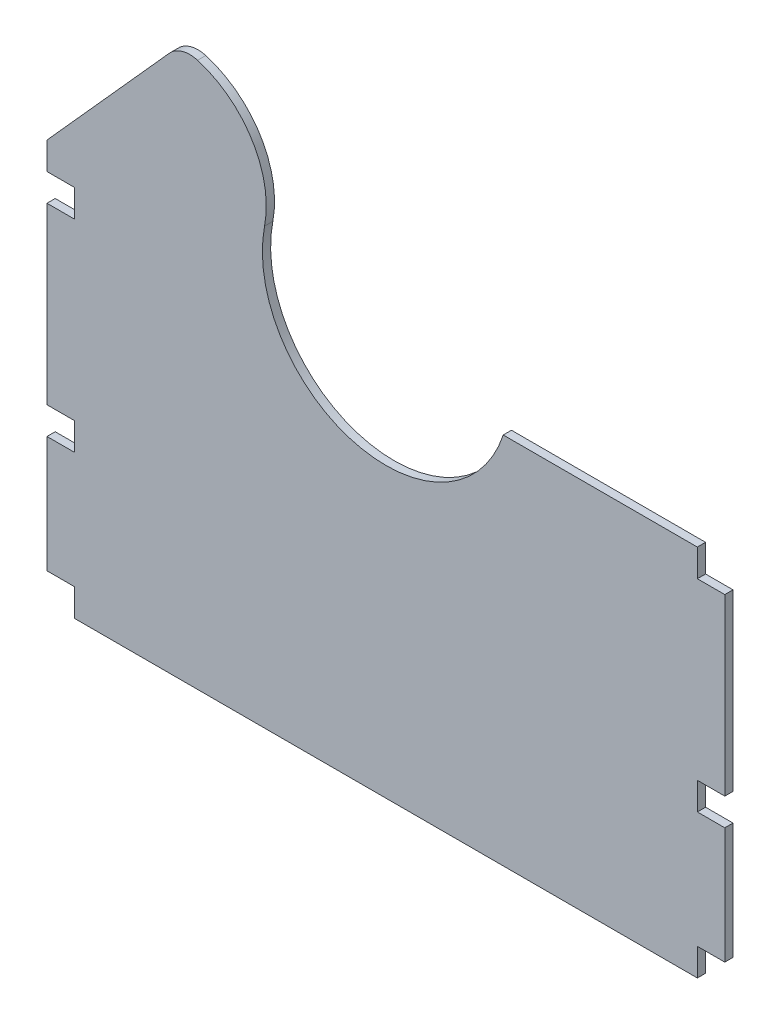
from build123d import *

# Parameters (mm, degrees)
BOSS_EXTRU_1_DEPTH      = 3
ENL_V_MAT_EXTRU_1_DEPTH = 345.268848431
ESQUISSE4_W             = 10
ESQUISSE4_H             = 10
ENL_V_MAT_EXTRU_2_DEPTH = 331.898715622
ENL_V_MAT_EXTRU_3_DEPTH = 331.898715622
CONG_2_R                = 10
ENL_V_MAT_EXTRU_4_DEPTH = 331.274729043


with BuildPart() as part:
    # Esquisse1 → Boss.-Extru.1 (new body)
    with BuildSketch(Plane.XY):
        Polygon((0, 0), (0, 127.45), (65.1, 200), (215.1, 200), (280.2, 127.45), (280.2, 0), align=None)
    extrude(amount=BOSS_EXTRU_1_DEPTH)

    # Esquisse2 → Enlèv. mat.-Extru.1 (cut, through all)
    with BuildSketch(Plane(origin=(0, 0, 0), x_dir=(-1, 0, 0), z_dir=(0, 0, -1))):
        Polygon((-16.6, 0), (-16.6, 145.969439351), (0, 127.45), (0, 0), align=None)
        Polygon((-280.2, 127.45), (-263.6, 145.969439351), (-263.6, 0), (-280.2, 0), align=None)
    extrude(amount=-ENL_V_MAT_EXTRU_1_DEPTH, mode=Mode.SUBTRACT)

    # Esquisse4 → Enlèv. mat.-Extru.2 (cut, through all)
    with BuildSketch(Plane.XY.offset(3)):
        with Locations((21.6, 5)):
            Rectangle(ESQUISSE4_W, ESQUISSE4_H)
        with Locations((21.6, 57.4)):
            Rectangle(ESQUISSE4_W, ESQUISSE4_H)
        with Locations((258.6, 131)):
            Rectangle(ESQUISSE4_W, ESQUISSE4_H)
        with Locations((21.6, 131)):
            Rectangle(ESQUISSE4_W, ESQUISSE4_H)
        with Locations((258.6, 57.4)):
            Rectangle(ESQUISSE4_W, ESQUISSE4_H)
        with Locations((258.6, 5)):
            Rectangle(ESQUISSE4_W, ESQUISSE4_H)
    extrude(amount=-ENL_V_MAT_EXTRU_2_DEPTH, mode=Mode.SUBTRACT)

    # Esquisse5 → Enlèv. mat.-Extru.3 (cut, through all)
    with BuildSketch(Plane.XY.offset(3)):
        with BuildLine():
            ThreePointArc((184.301907128, 158.4375), (191.711856965, 187.308210372), (218.681168228, 200))
            Line((218.681168228, 200), (215.1, 200))
            Line((215.1, 200), (140.1, 200))
            Line((140.1, 200), (65.1, 200))
            Line((65.1, 200), (61.518831772, 200))
            ThreePointArc((61.518831772, 200), (88.488143035, 187.308210372), (95.898092872, 158.4375))
            ThreePointArc((95.898092872, 158.4375), (140.1, 105), (184.301907128, 158.4375))
        make_face()
    extrude(amount=-ENL_V_MAT_EXTRU_3_DEPTH, mode=Mode.SUBTRACT)

    # Congé2
    cong_2_edges = [part.edges().sort_by_distance(p)[0] for p in [
        (64.94882545, 199.831525137, 1.5),
        (215.25117455, 199.831525137, 1.5),
    ]]
    fillet(cong_2_edges, radius=CONG_2_R)

    # Esquisse6 → Enlèv. mat.-Extru.4 (cut, through all)
    with BuildSketch(Plane.XY.offset(3)):
        Polygon((253.6, 136), (162.037145506, 136), (157.83002171, 194.744262237), (193.590573974, 207.065124781), (241.070971096, 207.065124781), (283.142209053, 167.698466408), (280.738138313, 136), (273.47498576, 135.479830357), align=None)
    extrude(amount=-ENL_V_MAT_EXTRU_4_DEPTH, mode=Mode.SUBTRACT)


solid = part.part
